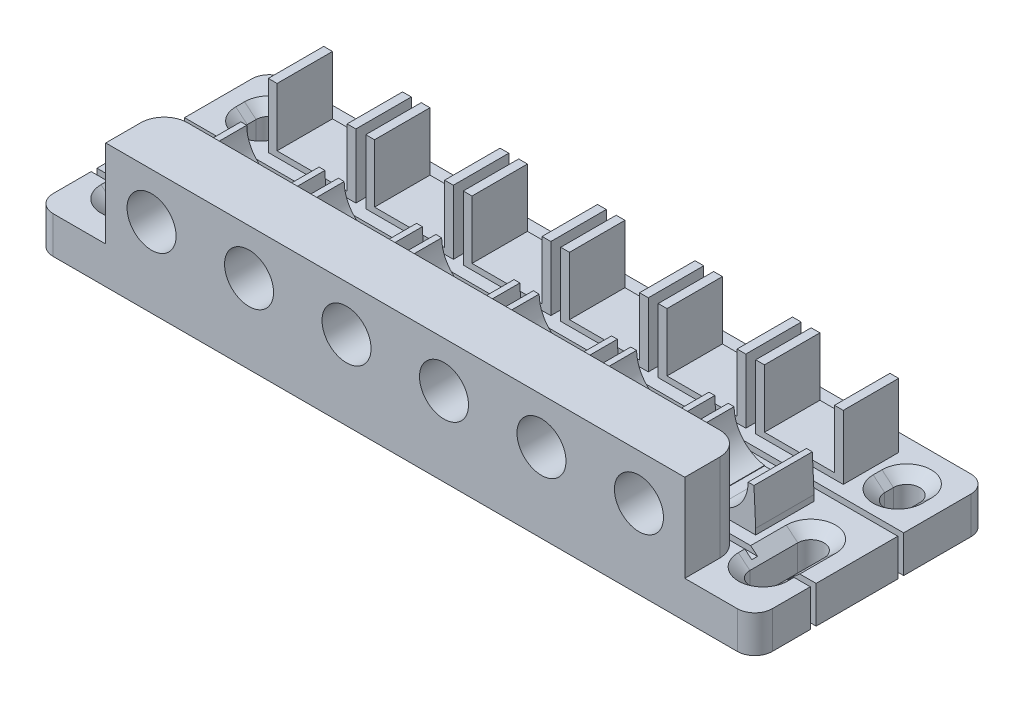
from build123d import *

# Parameters (mm, degrees)
SKETCH1_W                                    = 61.6
SKETCH1_H                                    = 40
BOSS_EXTRUDE1_DEPTH                          = 6.35
CSK_SLOT_FOR_8_FLAT_HEAD_MACHINE_SCREW_DEPTH = 6.35
FILLET1_R                                    = 3
SKETCH4_W                                    = 10
SKETCH4_H                                    = 15
BOSS_EXTRUDE2_DEPTH                          = 49.6
SKETCH6_R                                    = 4.2
CUT_EXTRUDE1_DEPTH                           = 9
CUT_EXTRUDE2_DEPTH                           = 72.766165426
CUT_EXTRUDE2_DEPTH_BACK                      = 72.766165426
SKETCH7_R                                    = 3
FILLET3_R                                    = 4
SKETCH20_W                                   = 1
SKETCH20_H                                   = 2
SKETCH24_W                                   = 15
SKETCH24_H                                   = 10
SKETCH24_H_2                                 = 9.5
BOSS_EXTRUDE3_DEPTH                          = 7.35
SKETCH25_W                                   = 1.5
SKETCH25_H                                   = 9.5
BOSS_EXTRUDE4_DEPTH                          = 10
BOSS_EXTRUDE5_START                          = -2.5
BOSS_EXTRUDE5_DEPTH                          = 10
LPATTERN3_COUNT                              = 3
LPATTERN3_PITCH                              = 16.7
CSK_START                                    = -1
CSK_SLOT_FOR_8_FLAT_HEAD_MACHINE_SC_4_DEPTH  = 7.35


with BuildPart() as part:
    # Sketch1 → Boss-Extrude1 (new body)
    with BuildSketch(Plane(origin=(0, 0, 0), x_dir=(1, 0, 0), z_dir=(0, 1, 0))):
        with Locations((-30.8, 0)):
            Rectangle(SKETCH1_W, SKETCH1_H)
    extrude(amount=BOSS_EXTRUDE1_DEPTH)

    # CSK SLOT for _8 Flat Head Machine Screw: read off the stored shape, not the designer's step
    # CSK SLOT for _8 Flat Head Machine Sc 2 → CSK SLOT for _8 Flat Head Machine Screw (cut)
    with BuildSketch(Plane(origin=(0, 0, 0), x_dir=(1, 0, 0), z_dir=(0, 1, 0))):
        with BuildLine():
            Line((-52.3521, -11.6021), (-52.3521, -3.3979))
            ThreePointArc((-52.3521, -3.3979), (-54.6, -1.15), (-56.8479, -3.3979))
            Line((-56.8479, -3.3979), (-56.8479, -11.6021))
            ThreePointArc((-56.8479, -11.6021), (-54.6, -13.85), (-52.3521, -11.6021))
        make_face()
    extrude(amount=CSK_SLOT_FOR_8_FLAT_HEAD_MACHINE_SCREW_DEPTH, mode=Mode.SUBTRACT)

    # CSK SLOT for _8 Flat Head Machine Sc 3: loft between two sections, ruled curve by curve
    csk_slot_for_8_flat_head_machine_sc_3_from = [
        Edge.make_three_point_arc((-52.3521, 4.698232376, 3.3979), (-53.010494667, 4.698232376, 1.808394667), (-54.6, 4.698232376, 1.15)),
        Edge.make_three_point_arc((-54.6, 4.698232376, 1.15), (-56.189505333, 4.698232376, 1.808394667), (-56.8479, 4.698232376, 3.3979)),
        Edge.make_three_point_arc((-56.8479, 4.698232376, 11.6021), (-56.189505333, 4.698232376, 13.191605333), (-54.6, 4.698232376, 13.85)),
        Edge.make_three_point_arc((-54.6, 4.698232376, 13.85), (-53.010494667, 4.698232376, 13.191605333), (-52.3521, 4.698232376, 11.6021)),
        Edge.make_line((-56.8479, 4.698232376, 3.3979), (-56.8479, 4.698232376, 11.6021)),
        Edge.make_line((-52.3521, 4.698232376, 3.3979), (-52.3521, 4.698232376, 11.6021)),
    ]
    csk_slot_for_8_flat_head_machine_sc_3_to = [
        Edge.make_three_point_arc((-50.3836, 6.35, 3.3979), (-51.618554968, 6.35, 0.416454968), (-54.6, 6.35, -0.8185)),
        Edge.make_three_point_arc((-54.6, 6.35, -0.8185), (-57.581445032, 6.35, 0.416454968), (-58.8164, 6.35, 3.3979)),
        Edge.make_three_point_arc((-58.8164, 6.35, 11.6021), (-57.581445032, 6.35, 14.583545032), (-54.6, 6.35, 15.8185)),
        Edge.make_three_point_arc((-54.6, 6.35, 15.8185), (-51.618554968, 6.35, 14.583545032), (-50.3836, 6.35, 11.6021)),
        Edge.make_line((-58.8164, 6.35, 3.3979), (-58.8164, 6.35, 11.6021)),
        Edge.make_line((-50.3836, 6.35, 3.3979), (-50.3836, 6.35, 11.6021)),
    ]
    csk_slot_for_8_flat_head_machine_sc_3 = Solid(Shell([*[Face.make_surface_from_curves(csk_slot_for_8_flat_head_machine_sc_3_from[k], csk_slot_for_8_flat_head_machine_sc_3_to[k]) for k in range(6)], Face(Wire(csk_slot_for_8_flat_head_machine_sc_3_from)), Face(Wire(csk_slot_for_8_flat_head_machine_sc_3_to))]))
    add(csk_slot_for_8_flat_head_machine_sc_3, mode=Mode.SUBTRACT)

    # Fillet1
    fillet1_edges = [part.edges().sort_by_distance(p)[0] for p in [
        (-61.6, 3.175, 20),
        (-61.6, 3.175, -20),
    ]]
    fillet(fillet1_edges, radius=FILLET1_R)

    # Sketch4 → Boss-Extrude2 (add)
    with BuildSketch(Plane(origin=(0, 0, 0), x_dir=(0, 0, -1), z_dir=(1, 0, 0))):
        with Locations((-15, 13.85)):
            Rectangle(SKETCH4_W, SKETCH4_H)
    extrude(amount=-BOSS_EXTRUDE2_DEPTH)

    # Sketch6 → Cut-Extrude1 (cut)
    with BuildSketch(Plane.XY.offset(20)):
        with Locations((-41.750257739, 13.55)):
            Circle(SKETCH6_R)
        with Locations((-25.050773216, 13.55)):
            Circle(SKETCH6_R)
        with Locations((-8.351288694, 13.55)):
            Circle(SKETCH6_R)
    extrude(amount=-CUT_EXTRUDE1_DEPTH, mode=Mode.SUBTRACT)

    # Sketch7 → Cut-Extrude2 (cut, two sides: drawn at the far end of the back side and taken through both)
    with BuildSketch(Plane(origin=(0, 0, 10), x_dir=(-1, 0, 0), z_dir=(0, 0, -1)).offset(-CUT_EXTRUDE2_DEPTH_BACK)):
        with Locations((8.351288694, 13.55)):
            Circle(SKETCH7_R)
        with Locations((25.050773216, 13.55)):
            Circle(SKETCH7_R)
        with Locations((41.750257739, 13.55)):
            Circle(SKETCH7_R)
    extrude(amount=CUT_EXTRUDE2_DEPTH + CUT_EXTRUDE2_DEPTH_BACK, mode=Mode.SUBTRACT)

    # Fillet3
    fillet3_edges = [part.edges().sort_by_distance(p)[0] for p in [
        (-49.6, 13.85, 10),
    ]]
    fillet(fillet3_edges, radius=FILLET3_R)

    # Cut-Sweep1: sweep along a path in Sketch13
    with BuildLine(Plane(origin=(0, 0, 10), x_dir=(-1, 0, 0), z_dir=(0, 0, -1))) as cut_sweep1_path:
        Line((0, 6.35), (61.6, 6.35))
        Line((61.6, 6.35), (61.6, 0))
    # Sketch15 → Cut-Sweep1 (sweep, cut)
    with BuildSketch(Plane(origin=(0, 0, 0), x_dir=(0, 0, -1), z_dir=(1, 0, 0))):
        Polygon((-10.5, 5.35), (-9.5, 5.35), (-9.5, 6.35), (-9.5, 10.244375646), (-10.5, 6.35), align=None)
    sweep(path=cut_sweep1_path.line, transition=Transition.RIGHT, mode=Mode.SUBTRACT)

    # Cut-Sweep2: sweep along a path in Sketch19
    with BuildLine(Plane(origin=(0, 0, -5), x_dir=(-1, 0, 0), z_dir=(0, 0, -1))) as cut_sweep2_path:
        Line((0, 6.35), (61.6, 6.35))
        Line((61.6, 6.35), (61.6, 0))
    # Sketch20 → Cut-Sweep2 (sweep, cut)
    with BuildSketch(Plane(origin=(0, 0, 0), x_dir=(0, 0, -1), z_dir=(1, 0, 0))):
        with Locations((5, 6.35)):
            Rectangle(SKETCH20_W, SKETCH20_H)
    sweep(path=cut_sweep2_path.line, transition=Transition.RIGHT, mode=Mode.SUBTRACT)

    # Sketch24 → Boss-Extrude3 (add)
    with BuildSketch(Plane.XZ):
        with Locations((-41.750257739, 2.5)):
            Rectangle(SKETCH24_W, SKETCH24_H)
        with Locations((-41.750257739, -12.25)):
            Rectangle(SKETCH24_W, SKETCH24_H_2)
    boss_extrude3 = extrude(amount=-BOSS_EXTRUDE3_DEPTH)

    # Sketch25 → Boss-Extrude4 (add)
    with BuildSketch(Plane(origin=(0, 7.35, 0), x_dir=(1, 0, 0), z_dir=(0, 1, 0))):
        with Locations((-35.000257739, 12.25)):
            Rectangle(SKETCH25_W, SKETCH25_H)
        with Locations((-48.500257739, 12.25)):
            Rectangle(SKETCH25_W, SKETCH25_H)
    boss_extrude4 = extrude(amount=BOSS_EXTRUDE4_DEPTH)

    # Sketch26 → Boss-Extrude5 (add)
    with BuildSketch(Plane.XY.offset(BOSS_EXTRUDE5_START)):
        with BuildLine():
            Line((-47.950257739, 13.55), (-48.950257739, 13.55))
            Line((-48.950257739, 13.55), (-49.250257739, 7.35))
            Line((-49.250257739, 7.35), (-42.750257739, 7.35))
            Line((-42.750257739, 7.35), (-42.750257739, 7.431176584))
            ThreePointArc((-42.750257739, 7.431176584), (-46.474662463, 9.53502802), (-47.950257739, 13.55))
        make_face()
        with BuildLine():
            Line((-34.250257739, 7.35), (-34.550257739, 13.55))
            Line((-34.550257739, 13.55), (-35.550257739, 13.55))
            ThreePointArc((-35.550257739, 13.55), (-37.025853014, 9.53502802), (-40.750257739, 7.431176584))
            Line((-40.750257739, 7.431176584), (-40.750257739, 7.35))
            Line((-40.750257739, 7.35), (-34.250257739, 7.35))
        make_face()
    boss_extrude5 = extrude(amount=BOSS_EXTRUDE5_DEPTH)

    # LPattern3: Boss-Extrude3, Boss-Extrude4, Boss-Extrude5 ×3
    with Locations(*[(i * LPATTERN3_PITCH, 0, 0) for i in range(1, LPATTERN3_COUNT)]):
        add(boss_extrude3)
        add(boss_extrude4)
        add(boss_extrude5)

    # CSK SLOT for _8 Flat Head Machine Sc 4: read off the stored shape, not the designer's step
    # CSK SLOT for _8 Flat Head Machine Sc 4 o → CSK SLOT for _8 Flat Head Machine Sc 4 (cut)
    with BuildSketch(Plane(origin=(0, 0, 0), x_dir=(1, 0, 0), z_dir=(0, 1, 0)).offset(CSK_START)):
        with BuildLine():
            ThreePointArc((-52.3521, 13.0021), (-54.6, 15.25), (-56.8479, 13.0021))
            Line((-56.8479, 13.0021), (-56.8479, 11.4979))
            ThreePointArc((-56.8479, 11.4979), (-54.6, 9.25), (-52.3521, 11.4979))
            Line((-52.3521, 11.4979), (-52.3521, 13.0021))
        make_face()
    extrude(amount=CSK_SLOT_FOR_8_FLAT_HEAD_MACHINE_SC_4_DEPTH, mode=Mode.SUBTRACT)

    # CSK SLOT for _8 Flat Head Machine Sc 4 2: loft between two sections, ruled curve by curve
    csk_slot_for_8_flat_head_machine_sc_4_2_from = [
        Edge.make_three_point_arc((-52.3521, 4.698232376, -13.0021), (-53.010494667, 4.698232376, -14.591605333), (-54.6, 4.698232376, -15.25)),
        Edge.make_three_point_arc((-54.6, 4.698232376, -15.25), (-56.189505333, 4.698232376, -14.591605333), (-56.8479, 4.698232376, -13.0021)),
        Edge.make_three_point_arc((-56.8479, 4.698232376, -11.4979), (-56.189505333, 4.698232376, -9.908394667), (-54.6, 4.698232376, -9.25)),
        Edge.make_three_point_arc((-54.6, 4.698232376, -9.25), (-53.010494667, 4.698232376, -9.908394667), (-52.3521, 4.698232376, -11.4979)),
        Edge.make_line((-56.8479, 4.698232376, -13.0021), (-56.8479, 4.698232376, -11.4979)),
        Edge.make_line((-52.3521, 4.698232376, -13.0021), (-52.3521, 4.698232376, -11.4979)),
    ]
    csk_slot_for_8_flat_head_machine_sc_4_2_to = [
        Edge.make_three_point_arc((-50.3836, 6.35, -13.0021), (-51.618554968, 6.35, -15.983545032), (-54.6, 6.35, -17.2185)),
        Edge.make_three_point_arc((-54.6, 6.35, -17.2185), (-57.581445032, 6.35, -15.983545032), (-58.8164, 6.35, -13.0021)),
        Edge.make_three_point_arc((-58.8164, 6.35, -11.4979), (-57.581445032, 6.35, -8.516454968), (-54.6, 6.35, -7.2815)),
        Edge.make_three_point_arc((-54.6, 6.35, -7.2815), (-51.618554968, 6.35, -8.516454968), (-50.3836, 6.35, -11.4979)),
        Edge.make_line((-58.8164, 6.35, -13.0021), (-58.8164, 6.35, -11.4979)),
        Edge.make_line((-50.3836, 6.35, -13.0021), (-50.3836, 6.35, -11.4979)),
    ]
    csk_slot_for_8_flat_head_machine_sc_4_2 = Solid(Shell([*[Face.make_surface_from_curves(csk_slot_for_8_flat_head_machine_sc_4_2_from[k], csk_slot_for_8_flat_head_machine_sc_4_2_to[k]) for k in range(6)], Face(Wire(csk_slot_for_8_flat_head_machine_sc_4_2_from)), Face(Wire(csk_slot_for_8_flat_head_machine_sc_4_2_to))]))
    add(csk_slot_for_8_flat_head_machine_sc_4_2, mode=Mode.SUBTRACT)

    # Mirror1: part across plane


with BuildPart() as part_1:
    add(part.part)
    add(part.part.mirror(Plane(origin=(0, 6.35, 20), x_dir=(0, 0, 1), z_dir=(-1, 0, 0))))


solid = part_1.part
